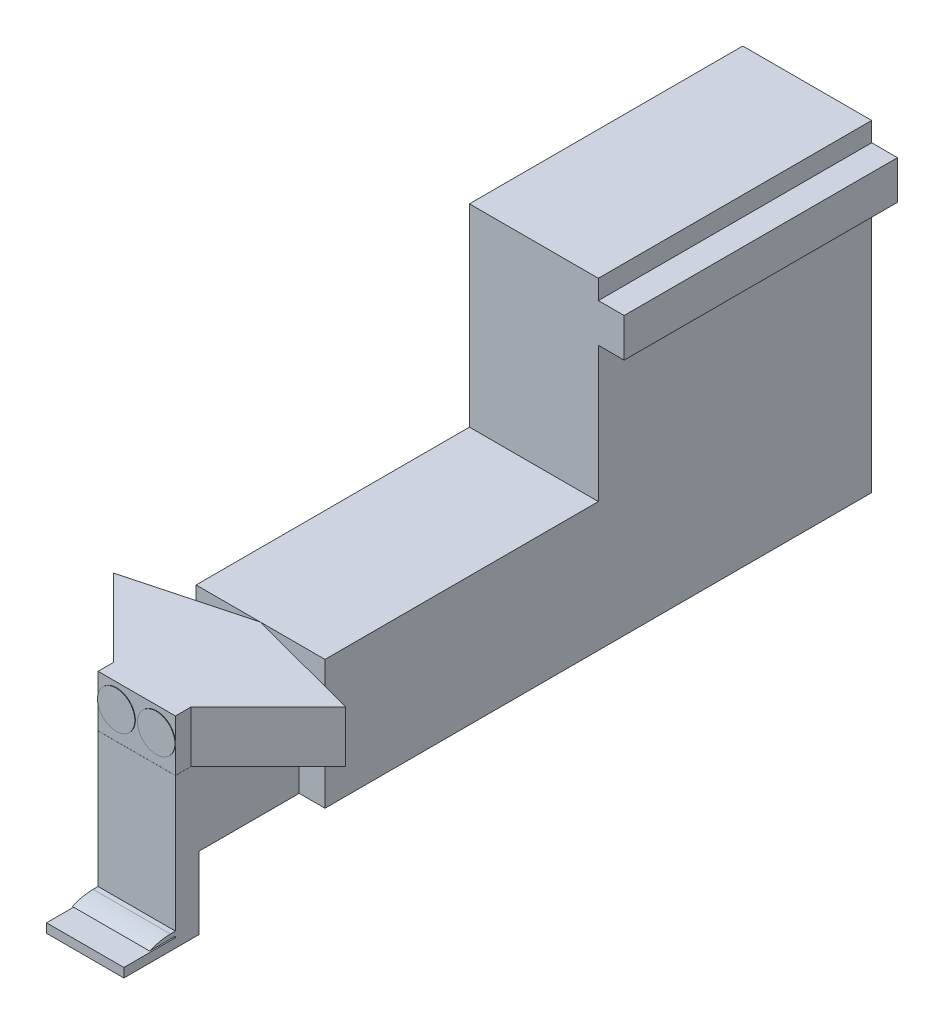
from build123d import *

# Parameters (mm, degrees)
BOSS_EXTRUDE1_DEPTH  = 26.5
SKETCH3_W            = 25
SKETCH3_H            = 25
BOSS_EXTRUDE2_DEPTH  = 53
BOSS_EXTRUDE3_DEPTH  = 10
SKETCH6_W            = 15
SKETCH6_H            = 24
BOSS_EXTRUDE9_DEPTH  = 14.99
BOSS_EXTRUDE10_DEPTH = 15
FILLET1_R            = 10
SKETCH9_R            = 3.625
BOSS_EXTRUDE11_DEPTH = 0.1


with BuildPart() as part:
    # Sketch2 → Boss-Extrude1 (new, symmetric)
    with BuildSketch(Plane.XY):
        Polygon((5, 3.75), (0, 3.75), (0, 7.5), (-25, 7.5), (-25, -55), (0, -55), (0, -3.75), (5, -3.75), align=None)
    extrude(amount=BOSS_EXTRUDE1_DEPTH, both=True)

    # Sketch3 → Boss-Extrude2 (add)
    with BuildSketch(Plane.XY.offset(26.5)):
        with Locations((-12.5, -42.5)):
            Rectangle(SKETCH3_W, SKETCH3_H)
    extrude(amount=BOSS_EXTRUDE2_DEPTH)

    # Sketch6 → Boss-Extrude9 (add)
    with BuildSketch(Plane.XZ.offset(55)):
        with Locations((-12.5, 91.5)):
            Rectangle(SKETCH6_W, SKETCH6_H)
    extrude(amount=-BOSS_EXTRUDE9_DEPTH)

    # Sketch8 → Boss-Extrude10 (add)
    with BuildSketch(Plane(origin=(-5, 0, 0), x_dir=(0, 0, -1), z_dir=(1, 0, 0))):
        Polygon((-103.5, -55), (-98.9, -55), (-98.9, -69), (-103.5, -69), (-113.5, -69), (-113.5, -67.23), (-103.5, -67.23), (-103.5, -66.98), (-108.5, -66.98), (-108.5, -66.13), (-103.5, -66.13), align=None)
    extrude(amount=-BOSS_EXTRUDE10_DEPTH)

    # Fillet1
    # the kernel refuses this fillet: 10 mm, written as the material it takes off along each edge
    with BuildSketch(Plane(origin=(5.086345969, -66.13, 108.5), x_dir=(0, 0, -1), z_dir=(-1, 0, 0))) as fillet1_piece_1:
        with BuildLine():
            CenterArc((4.034538387, 10), FILLET1_R, 246.205727049, 23.794272951)
            Line((0, 0.85), (0, 0))
            Line((0, 0), (4.034538387, 0))
        make_face()
    extrude(amount=35.172691937, mode=Mode.SUBTRACT)


with BuildPart() as body_2:
    # Sketch4 → Boss-Extrude3 (new body)
    with BuildSketch(Plane(origin=(0, -30, 0), x_dir=(1, 0, 0), z_dir=(0, 1, 0))):
        Polygon((-12.5, -79.5), (-35, -85.5), (-20, -100.5), (-20, -103.5), (-5, -103.5), (-5, -100.5), (10, -85.5), align=None)
    extrude(amount=-BOSS_EXTRUDE3_DEPTH)

    # Sketch9 → Boss-Extrude11 (add)
    with BuildSketch(Plane.XY.offset(103.5)):
        with Locations(Location((-16.398016516, -34.592152012, 0), (0, 0, 173.539985727))):
            Circle(SKETCH9_R)
        with Locations((-8.625, -34.592152012)):
            Circle(SKETCH9_R)
    extrude(amount=BOSS_EXTRUDE11_DEPTH)


solid = Compound([part.part, body_2.part])
